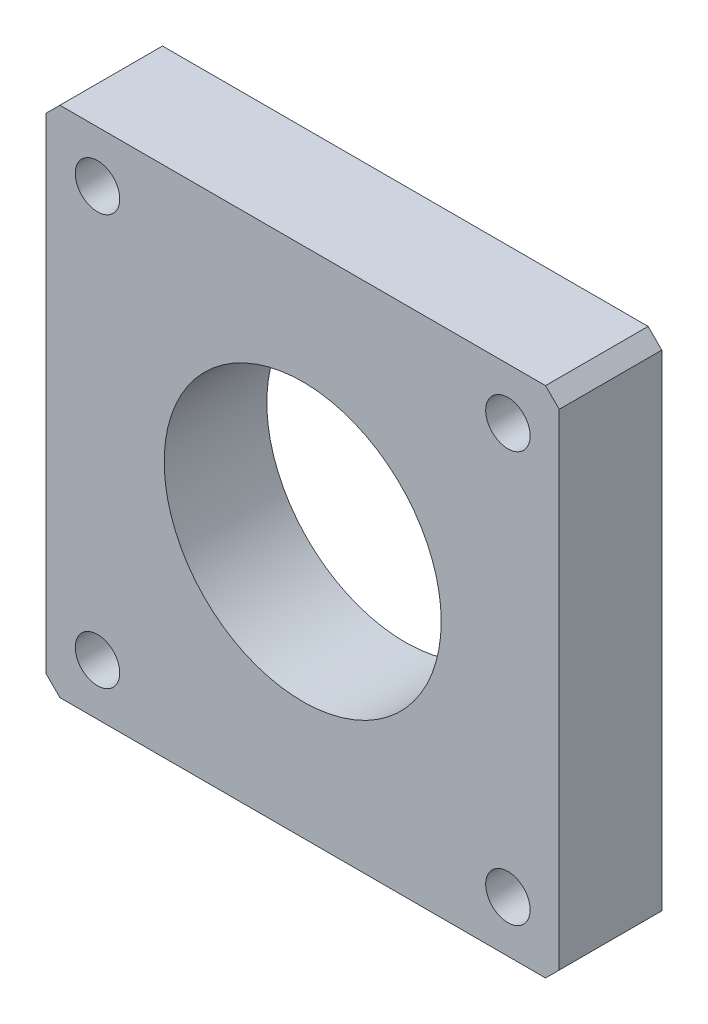
from build123d import *

# Parameters (mm, degrees)
SKETCH_1_W          = 75
SKETCH_1_H          = 75
EXTRUDE_1_DEPTH     = 15
CHAMFER_1_SIZE      = 2
SKETCH_2_R          = 20.25
SKETCH_2_R_2        = 3.25
CUT_EXTRUDE_1_DEPTH = 108.121426428


with BuildPart() as part:
    # 草图1 → 凸台-拉伸1 (new body)
    with BuildSketch(Plane.XY):
        with Locations((37.5, -37.5)):
            Rectangle(SKETCH_1_W, SKETCH_1_H)
    extrude(amount=EXTRUDE_1_DEPTH)

    # 倒角1
    chamfer_1_edges = [part.edges().sort_by_distance(p)[0] for p in [
        (75, -75, 7.5),
        (75, 0, 7.5),
        (0, -75, 7.5),
        (0, 0, 7.5),
    ]]
    chamfer(chamfer_1_edges, length=CHAMFER_1_SIZE)

    # 草图2 → 切除-拉伸1 (cut, through all)
    with BuildSketch(Plane.XY.offset(15)):
        with Locations((37.5, -37.5)):
            Circle(SKETCH_2_R)
        with Locations((7.5, -7.5)):
            Circle(SKETCH_2_R_2)
        with Locations((67.5, -7.5)):
            Circle(SKETCH_2_R_2)
        with Locations((67.5, -67.5)):
            Circle(SKETCH_2_R_2)
        with Locations((7.5, -67.5)):
            Circle(SKETCH_2_R_2)
    extrude(amount=-CUT_EXTRUDE_1_DEPTH, mode=Mode.SUBTRACT)


solid = part.part
